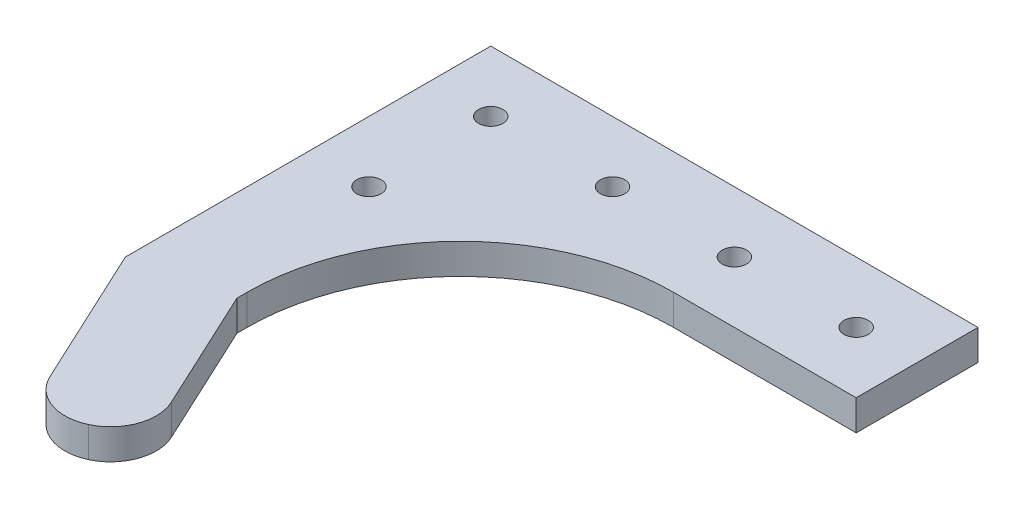
from build123d import *

# Parameters (mm, degrees)
BOSS_EXTRUDE1_DEPTH = 6.35
SKETCH2_R           = 2.54
CUT_EXTRUDE1_DEPTH  = 6.35
FILLET1_R           = 9.525


with BuildPart() as part:
    # Sketch1 → Boss-Extrude1 (new body)
    with BuildSketch(Plane(origin=(0, 0, 0), x_dir=(1, 0, 0), z_dir=(0, 1, 0))):
        with BuildLine():
            Line((0, 0), (0, -76.2))
            Line((0, -76.2), (17.766321776, -114.3))
            Line((17.766321776, -114.3), (35.031485119, -106.249122114))
            Line((35.031485119, -106.249122114), (19.05, -71.976716677))
            Line((19.05, -71.976716677), (19.05, -69.85))
            ThreePointArc((19.05, -69.85), (32.069103576, -38.419103576), (63.5, -25.4))
            Line((63.5, -25.4), (101.6, -25.4))
            Line((101.6, -25.4), (101.6, 0))
            Line((101.6, 0), (0, 0))
        make_face()
    extrude(amount=BOSS_EXTRUDE1_DEPTH)

    # Sketch2 → Cut-Extrude1 (cut)
    with BuildSketch(Plane(origin=(0, 6.35, 0), x_dir=(1, 0, 0), z_dir=(0, 1, 0))):
        with Locations(Location((12.7, -12.7, 0), (0, 0, 270))):
            Circle(SKETCH2_R)
        with Locations(Location((38.1, -12.7, 0), (0, 0, 270))):
            Circle(SKETCH2_R)
        with Locations(Location((63.5, -12.7, 0), (0, 0, 270))):
            Circle(SKETCH2_R)
        with Locations(Location((88.9, -12.7, 0), (0, 0, 270))):
            Circle(SKETCH2_R)
        with Locations((114.3, -12.7)):
            Circle(SKETCH2_R)
        with Locations((139.7, -12.7)):
            Circle(SKETCH2_R)
        with Locations(Location((12.7, -38.1, 0), (0, 0, 270))):
            Circle(SKETCH2_R)
    extrude(amount=-CUT_EXTRUDE1_DEPTH, mode=Mode.SUBTRACT)

    # Fillet1
    fillet1_edges = [part.edges().sort_by_distance(p)[0] for p in [
        (17.766321776, 3.175, 114.3),
        (35.031485119, 3.175, 106.249122114),
    ]]
    fillet(fillet1_edges, radius=FILLET1_R - 0.0001)  # a hair under: the kernel refuses the full size


solid = part.part
